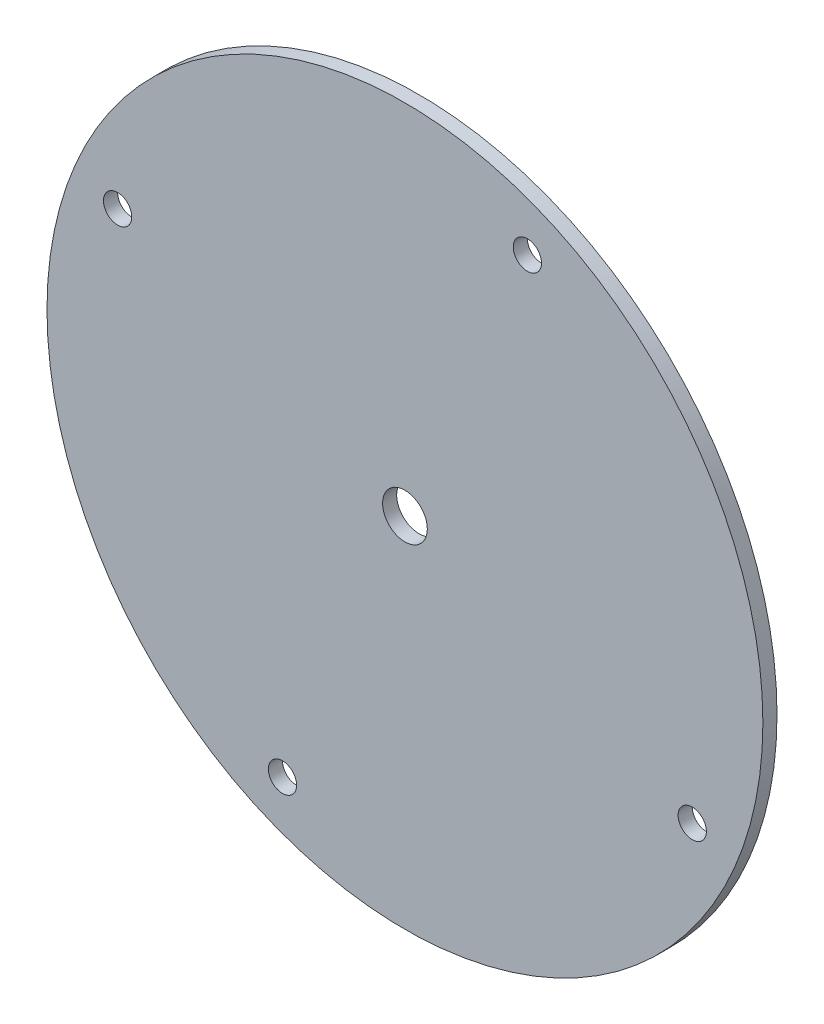
from build123d import *

# Parameters (mm, degrees)
SKETCH1_R           = 76
SKETCH1_R_2         = 3
BOSS_EXTRUDE3_DEPTH = 3
SKETCH2_R           = 4.75
CUT_EXTRUDE1_DEPTH  = 108.522090753


with BuildPart() as part:
    # Sketch1 → Boss-Extrude3 (new body)
    with BuildSketch(Plane.XY):
        Circle(SKETCH1_R)
        with Locations((26, 61)):
            Circle(SKETCH1_R_2, mode=Mode.SUBTRACT)
        with Locations((-26, -61)):
            Circle(SKETCH1_R_2, mode=Mode.SUBTRACT)
        with Locations((61, -26)):
            Circle(SKETCH1_R_2, mode=Mode.SUBTRACT)
        with Locations((-61, 26)):
            Circle(SKETCH1_R_2, mode=Mode.SUBTRACT)
    extrude(amount=BOSS_EXTRUDE3_DEPTH)

    # Sketch2 → Cut-Extrude1 (cut, through all)
    with BuildSketch(Plane.XY.offset(3)):
        Circle(SKETCH2_R)
    extrude(amount=-CUT_EXTRUDE1_DEPTH, mode=Mode.SUBTRACT)


solid = part.part
